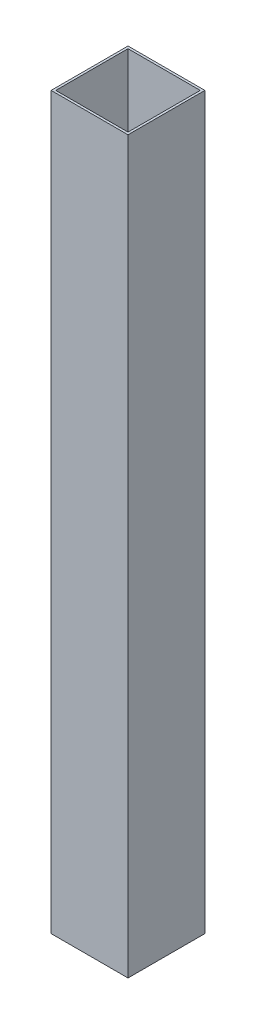
from build123d import *

# Parameters (mm, degrees)
SKETCH1_W           = 50.8
SKETCH1_H           = 50.8
SKETCH1_W_2         = 47.752
SKETCH1_H_2         = 47.752
EXTRUDE_THIN1_DEPTH = 482.6


with BuildPart() as part:
    # Sketch1 → Extrude-Thin1 (new body)
    with BuildSketch(Plane(origin=(0, 0, 0), x_dir=(1, 0, 0), z_dir=(0, 1, 0))):
        Rectangle(SKETCH1_W, SKETCH1_H)
        Rectangle(SKETCH1_W_2, SKETCH1_H_2, mode=Mode.SUBTRACT)
    extrude(amount=EXTRUDE_THIN1_DEPTH)


solid = part.part
